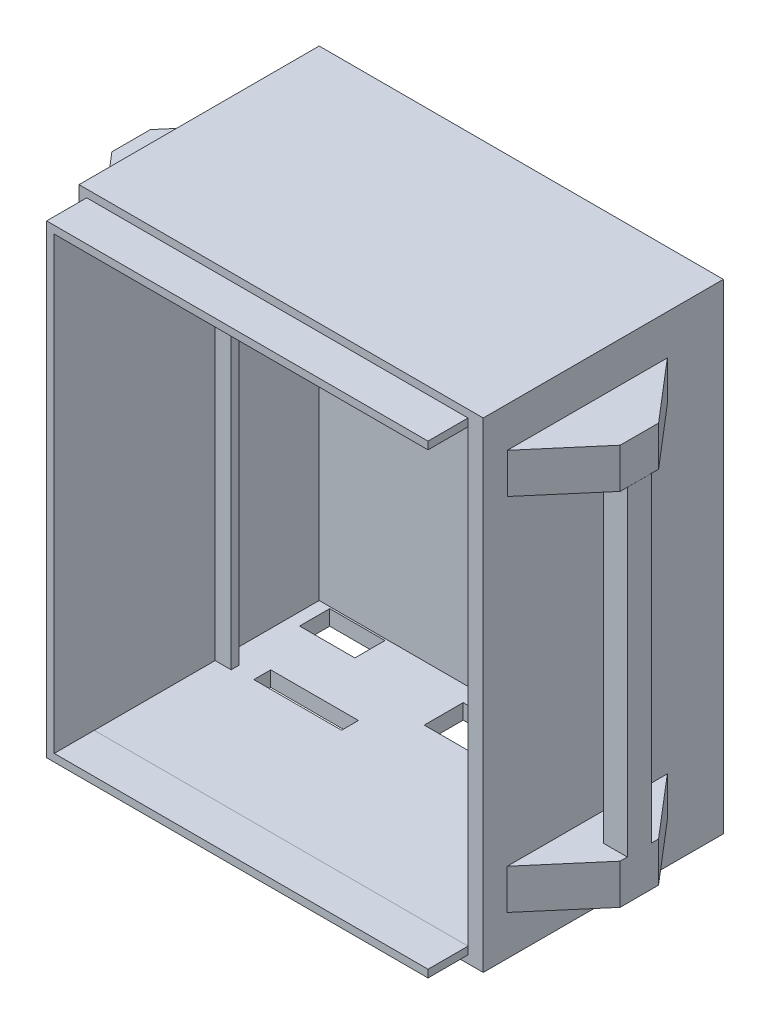
from build123d import *

# Parameters (mm, degrees)
SCHIZZO1_W                    = 50.5
SCHIZZO1_H                    = 60
ESTRUSIONE_ESTRUSIONE1_DEPTH  = 1.9
SCHIZZO2_W                    = 1.9
SCHIZZO2_H                    = 60
ESTRUSIONE_ESTRUSIONE2_DEPTH  = 30
SCHIZZO3_W                    = 48.6
SCHIZZO3_H                    = 1.9
ESTRUSIONE_ESTRUSIONE3_DEPTH  = 30
SCHIZZO4_W                    = 1.9
SCHIZZO4_H                    = 58.1
ESTRUSIONE_ESTRUSIONE4_DEPTH  = 30
SCHIZZO5_W                    = 46.7
SCHIZZO5_H                    = 1.9
ESTRUSIONE_ESTRUSIONE5_DEPTH  = 30
SCHIZZO6_W                    = 4.6
SCHIZZO6_H                    = 39.07690979
ESTRUSIONE_ESTRUSIONE6_DEPTH  = 13
SCHIZZO7_W                    = 23.476572129
SCHIZZO7_H                    = 4.659918653
ESTRUSIONE_ESTRUSIONE7_DEPTH  = 13
SCHIZZO8_W                    = 1
SCHIZZO8_H                    = 42.069064227
ESTRUSIONE_ESTRUSIONE8_DEPTH  = 2
SCHIZZO9_W                    = 1.5
SCHIZZO9_H                    = 17.12309021
ESTRUSIONE_ESTRUSIONE9_DEPTH  = 4
SCHIZZO10_W                   = 1.5
SCHIZZO10_H                   = 9.47101712
ESTRUSIONE_ESTRUSIONE10_DEPTH = 4
SCHIZZO11_W                   = 6.905155868
SCHIZZO11_H                   = 3.764387107
TAGLIO_ESTRUSIONE1_DEPTH      = 2
SCHIZZO13_W                   = 15.903630787
SCHIZZO13_H                   = 4.865229634
TAGLIO_ESTRUSIONE2_DEPTH      = 2
SCHIZZO14_W                   = 10.95879518
SCHIZZO14_H                   = 2.106581553
TAGLIO_ESTRUSIONE3_DEPTH      = 2
SCHIZZO15_W                   = 20
SCHIZZO15_H                   = 5
ESTRUSIONE_ESTRUSIONE11_DEPTH = 6.5
SCHIZZO16_W                   = 3
SCHIZZO16_H                   = 3
ESTRUSIONE_ESTRUSIONE12_DEPTH = 40
SCHIZZO17_W                   = 20
SCHIZZO17_H                   = 5
ESTRUSIONE_ESTRUSIONE13_DEPTH = 6.5
TAGLIO_ESTRUSIONE4_DEPTH      = 6.5
TAGLIO_ESTRUSIONE5_DEPTH      = 6.5
TAGLIO_ESTRUSIONE6_DEPTH      = 6.5
TAGLIO_ESTRUSIONE7_DEPTH      = 6.5
SCHIZZO22_W                   = 20.001352525
SCHIZZO22_H                   = 5
ESTRUSIONE_ESTRUSIONE14_DEPTH = 6.5
SCHIZZO23_W                   = 3
SCHIZZO23_H                   = 3
ESTRUSIONE_ESTRUSIONE15_DEPTH = 40
SCHIZZO24_W                   = 20.00326161
SCHIZZO24_H                   = 5
ESTRUSIONE_ESTRUSIONE16_DEPTH = 6.5
TAGLIO_ESTRUSIONE8_DEPTH      = 6.5
TAGLIO_ESTRUSIONE9_DEPTH      = 6.5
TAGLIO_ESTRUSIONE10_DEPTH     = 6.5
TAGLIO_ESTRUSIONE11_DEPTH     = 6.5
SCHIZZO29_W                   = 1.9
SCHIZZO29_H                   = 58.1
TAGLIO_ESTRUSIONE12_DEPTH     = 1.9
SCHIZZO30_W                   = 50.5
SCHIZZO30_H                   = 1.9
TAGLIO_ESTRUSIONE13_DEPTH     = 1.9
SCHIZZO31_W                   = 1.9
SCHIZZO31_H                   = 58.1
TAGLIO_ESTRUSIONE14_DEPTH     = 1.9
SCHIZZO32_W                   = 46.7
SCHIZZO32_H                   = 1.9
TAGLIO_ESTRUSIONE15_DEPTH     = 1.9
SCHIZZO33_W                   = 46.7
SCHIZZO33_H                   = 0.95
ESTRUSIONE_ESTRUSIONE17_DEPTH = 5
SCHIZZO34_W                   = 0.95
SCHIZZO34_H                   = 57.146124021
ESTRUSIONE_ESTRUSIONE18_DEPTH = 5
SCHIZZO35_W                   = 47.649959538
SCHIZZO35_H                   = 0.95
ESTRUSIONE_ESTRUSIONE19_DEPTH = 5


with BuildPart() as part:
    # Schizzo1 → Estrusione-Estrusione1 (new body)
    with BuildSketch(Plane.XY):
        with Locations((25.25, 30)):
            Rectangle(SCHIZZO1_W, SCHIZZO1_H)
    extrude(amount=ESTRUSIONE_ESTRUSIONE1_DEPTH)

    # Schizzo2 → Estrusione-Estrusione2 (add)
    with BuildSketch(Plane.XY.offset(1.9)):
        with Locations((0.95, 30)):
            Rectangle(SCHIZZO2_W, SCHIZZO2_H)
    extrude(amount=ESTRUSIONE_ESTRUSIONE2_DEPTH)

    # Schizzo3 → Estrusione-Estrusione3 (add)
    with BuildSketch(Plane.XY.offset(1.9)):
        with Locations((26.2, 0.95)):
            Rectangle(SCHIZZO3_W, SCHIZZO3_H)
    extrude(amount=ESTRUSIONE_ESTRUSIONE3_DEPTH)

    # Schizzo4 → Estrusione-Estrusione4 (add)
    with BuildSketch(Plane.XY.offset(1.9)):
        with Locations((49.55, 30.95)):
            Rectangle(SCHIZZO4_W, SCHIZZO4_H)
    extrude(amount=ESTRUSIONE_ESTRUSIONE4_DEPTH)

    # Schizzo5 → Estrusione-Estrusione5 (add)
    with BuildSketch(Plane.XY.offset(1.9)):
        with Locations((25.25, 59.05)):
            Rectangle(SCHIZZO5_W, SCHIZZO5_H)
    extrude(amount=ESTRUSIONE_ESTRUSIONE5_DEPTH)

    # Schizzo6 → Estrusione-Estrusione6 (add)
    with BuildSketch(Plane.XY.offset(1.9)):
        with Locations((46.3, 21.438454895)):
            Rectangle(SCHIZZO6_W, SCHIZZO6_H)
    extrude(amount=ESTRUSIONE_ESTRUSIONE6_DEPTH)

    # Schizzo7 → Estrusione-Estrusione7 (add)
    with BuildSketch(Plane.XY.offset(1.9)):
        with Locations((13.638286065, 46.299023554)):
            Rectangle(SCHIZZO7_W, SCHIZZO7_H)
    extrude(amount=ESTRUSIONE_ESTRUSIONE7_DEPTH)

    # Schizzo8 → Estrusione-Estrusione8 (add)
    with BuildSketch(Plane(origin=(1.9, 0, 0), x_dir=(0, 0, -1), z_dir=(1, 0, 0))):
        with Locations((-14.4, 22.934532114)):
            Rectangle(SCHIZZO8_W, SCHIZZO8_H)
    extrude(amount=ESTRUSIONE_ESTRUSIONE8_DEPTH)

    # Schizzo9 → Estrusione-Estrusione9 (add)
    with BuildSketch(Plane.ZY.offset(-48.6)):
        with Locations((14.15, 49.538454895)):
            Rectangle(SCHIZZO9_W, SCHIZZO9_H)
    extrude(amount=ESTRUSIONE_ESTRUSIONE9_DEPTH)

    # Schizzo10 → Estrusione-Estrusione10 (add)
    with BuildSketch(Plane(origin=(1.9, 0, 0), x_dir=(0, 0, -1), z_dir=(1, 0, 0))):
        with Locations((-14.15, 53.36449144)):
            Rectangle(SCHIZZO10_W, SCHIZZO10_H)
    extrude(amount=ESTRUSIONE_ESTRUSIONE10_DEPTH)

    # Schizzo11 → Taglio-Estrusione1 (cut)
    with BuildSketch(Plane(origin=(0, 0, 0), x_dir=(-1, 0, 0), z_dir=(0, -1, 0))):
        with Locations((-6.89178475, -4.002985694)):
            Rectangle(SCHIZZO11_W, SCHIZZO11_H)
    extrude(amount=-TAGLIO_ESTRUSIONE1_DEPTH, mode=Mode.SUBTRACT)

    # Schizzo13 → Taglio-Estrusione2 (cut)
    with BuildSketch(Plane(origin=(0, 0, 0), x_dir=(-1, 0, 0), z_dir=(0, -1, 0))):
        with Locations((-29.895255689, -6.384557983)):
            Rectangle(SCHIZZO13_W, SCHIZZO13_H)
    extrude(amount=-TAGLIO_ESTRUSIONE2_DEPTH, mode=Mode.SUBTRACT)

    # Schizzo14 → Taglio-Estrusione3 (cut)
    with BuildSketch(Plane.XZ):
        with Locations((11.855335678, 13.484586242)):
            Rectangle(SCHIZZO14_W, SCHIZZO14_H)
    extrude(amount=-TAGLIO_ESTRUSIONE3_DEPTH, mode=Mode.SUBTRACT)

    # Schizzo15 → Estrusione-Estrusione11 (add)
    with BuildSketch(Plane(origin=(50.5, 0, 0), x_dir=(0, 0, -1), z_dir=(1, 0, 0))):
        with Locations((-17.001462523, 7.495543078)):
            Rectangle(SCHIZZO15_W, SCHIZZO15_H)
    extrude(amount=ESTRUSIONE_ESTRUSIONE11_DEPTH)

    # Schizzo16 → Estrusione-Estrusione12 (add)
    with BuildSketch(Plane(origin=(0, 9.995543078, 0), x_dir=(1, 0, 0), z_dir=(0, 1, 0))):
        with Locations((55.5, -17.002009902)):
            Rectangle(SCHIZZO16_W, SCHIZZO16_H)
    extrude(amount=ESTRUSIONE_ESTRUSIONE12_DEPTH)

    # Schizzo17 → Estrusione-Estrusione13 (add)
    with BuildSketch(Plane(origin=(50.5, 0, 0), x_dir=(0, 0, -1), z_dir=(1, 0, 0))):
        with Locations((-16.998938605, 52.501542019)):
            Rectangle(SCHIZZO17_W, SCHIZZO17_H)
    extrude(amount=ESTRUSIONE_ESTRUSIONE13_DEPTH)

    # Schizzo18 → Taglio-Estrusione4 (cut)
    with BuildSketch(Plane.XZ.offset(-4.995543078)):
        Polygon((57, 27.001462523), (50.5, 27.001462523), (57, 19.396274061), align=None)
    extrude(amount=-TAGLIO_ESTRUSIONE4_DEPTH, mode=Mode.SUBTRACT)

    # Schizzo19 → Taglio-Estrusione5 (cut)
    with BuildSketch(Plane.XZ.offset(-4.995543078)):
        Polygon((57, 7.001462523), (50.5, 7.001462523), (57, 14.597658378), align=None)
    extrude(amount=-TAGLIO_ESTRUSIONE5_DEPTH, mode=Mode.SUBTRACT)

    # Schizzo20 → Taglio-Estrusione6 (cut)
    with BuildSketch(Plane(origin=(0, 55.001542019, 0), x_dir=(1, 0, 0), z_dir=(0, 1, 0))):
        Polygon((57, -26.998938605), (50.5, -26.998938605), (57, -19.389527853), align=None)
    extrude(amount=-TAGLIO_ESTRUSIONE6_DEPTH, mode=Mode.SUBTRACT)

    # Schizzo21 → Taglio-Estrusione7 (cut)
    with BuildSketch(Plane(origin=(0, 55.001542019, 0), x_dir=(1, 0, 0), z_dir=(0, 1, 0))):
        Polygon((57, -6.998938605), (50.5, -6.998938605), (57, -14.591755232), align=None)
    extrude(amount=-TAGLIO_ESTRUSIONE7_DEPTH, mode=Mode.SUBTRACT)

    # Schizzo22 → Estrusione-Estrusione14 (add)
    with BuildSketch(Plane.ZY):
        with Locations((16.995641234, 7.503764192)):
            Rectangle(SCHIZZO22_W, SCHIZZO22_H)
    extrude(amount=ESTRUSIONE_ESTRUSIONE14_DEPTH)

    # Schizzo23 → Estrusione-Estrusione15 (add)
    with BuildSketch(Plane(origin=(0, 10.003764192, 0), x_dir=(1, 0, 0), z_dir=(0, 1, 0))):
        with Locations((-5, -16.99919375)):
            Rectangle(SCHIZZO23_W, SCHIZZO23_H)
    extrude(amount=ESTRUSIONE_ESTRUSIONE15_DEPTH)

    # Schizzo24 → Estrusione-Estrusione16 (add)
    with BuildSketch(Plane.ZY):
        with Locations((17.000546308, 52.500495178)):
            Rectangle(SCHIZZO24_W, SCHIZZO24_H)
    extrude(amount=ESTRUSIONE_ESTRUSIONE16_DEPTH)

    # Schizzo25 → Taglio-Estrusione8 (cut)
    with BuildSketch(Plane(origin=(0, 5.003764192, 0), x_dir=(-1, 0, 0), z_dir=(0, -1, 0))):
        Polygon((6.5, -6.994964971), (0, -6.994964971), (6.5, -14.588932537), align=None)
    extrude(amount=-TAGLIO_ESTRUSIONE8_DEPTH, mode=Mode.SUBTRACT)

    # Schizzo26 → Taglio-Estrusione9 (cut)
    with BuildSketch(Plane(origin=(0, 5.003764192, 0), x_dir=(-1, 0, 0), z_dir=(0, -1, 0))):
        Polygon((6.5, -26.996317496), (0, -26.996317496), (6.5, -19.40143242), align=None)
    extrude(amount=-TAGLIO_ESTRUSIONE9_DEPTH, mode=Mode.SUBTRACT)

    # Schizzo27 → Taglio-Estrusione10 (cut)
    with BuildSketch(Plane(origin=(0, 55.000495178, 0), x_dir=(1, 0, 0), z_dir=(0, 1, 0))):
        Polygon((-6.5, -27.002177113), (0, -27.002177113), (-6.5, -19.40143242), align=None)
    extrude(amount=-TAGLIO_ESTRUSIONE10_DEPTH, mode=Mode.SUBTRACT)

    # Schizzo28 → Taglio-Estrusione11 (cut)
    with BuildSketch(Plane(origin=(0, 55.000495178, 0), x_dir=(1, 0, 0), z_dir=(0, 1, 0))):
        Polygon((-6.5, -6.998915503), (0, -6.998915503), (-6.5, -14.588932537), align=None)
    extrude(amount=-TAGLIO_ESTRUSIONE11_DEPTH, mode=Mode.SUBTRACT)

    # Schizzo29 → Taglio-Estrusione12 (cut)
    with BuildSketch(Plane.XY.offset(31.9)):
        with Locations((0.95, 30.95)):
            Rectangle(SCHIZZO29_W, SCHIZZO29_H)
    extrude(amount=-TAGLIO_ESTRUSIONE12_DEPTH, mode=Mode.SUBTRACT)

    # Schizzo30 → Taglio-Estrusione13 (cut)
    with BuildSketch(Plane.XY.offset(31.9)):
        with Locations((25.25, 0.95)):
            Rectangle(SCHIZZO30_W, SCHIZZO30_H)
    extrude(amount=-TAGLIO_ESTRUSIONE13_DEPTH, mode=Mode.SUBTRACT)

    # Schizzo31 → Taglio-Estrusione14 (cut)
    with BuildSketch(Plane.XY.offset(31.9)):
        with Locations((49.55, 30.95)):
            Rectangle(SCHIZZO31_W, SCHIZZO31_H)
    extrude(amount=-TAGLIO_ESTRUSIONE14_DEPTH, mode=Mode.SUBTRACT)

    # Schizzo32 → Taglio-Estrusione15 (cut)
    with BuildSketch(Plane.XY.offset(31.9)):
        with Locations((25.25, 59.05)):
            Rectangle(SCHIZZO32_W, SCHIZZO32_H)
    extrude(amount=-TAGLIO_ESTRUSIONE15_DEPTH, mode=Mode.SUBTRACT)

    # Schizzo33 → Estrusione-Estrusione17 (add)
    with BuildSketch(Plane.XY.offset(30)):
        with Locations((25.25, 58.575)):
            Rectangle(SCHIZZO33_W, SCHIZZO33_H)
    extrude(amount=ESTRUSIONE_ESTRUSIONE17_DEPTH)

    # Schizzo34 → Estrusione-Estrusione18 (add)
    with BuildSketch(Plane.XY.offset(30)):
        with Locations((1.425, 30.47693799)):
            Rectangle(SCHIZZO34_W, SCHIZZO34_H)
    extrude(amount=ESTRUSIONE_ESTRUSIONE18_DEPTH)

    # Schizzo35 → Estrusione-Estrusione19 (add)
    with BuildSketch(Plane.XY.offset(30)):
        with Locations((24.774979769, 1.428875979)):
            Rectangle(SCHIZZO35_W, SCHIZZO35_H)
    extrude(amount=ESTRUSIONE_ESTRUSIONE19_DEPTH)


solid = part.part
